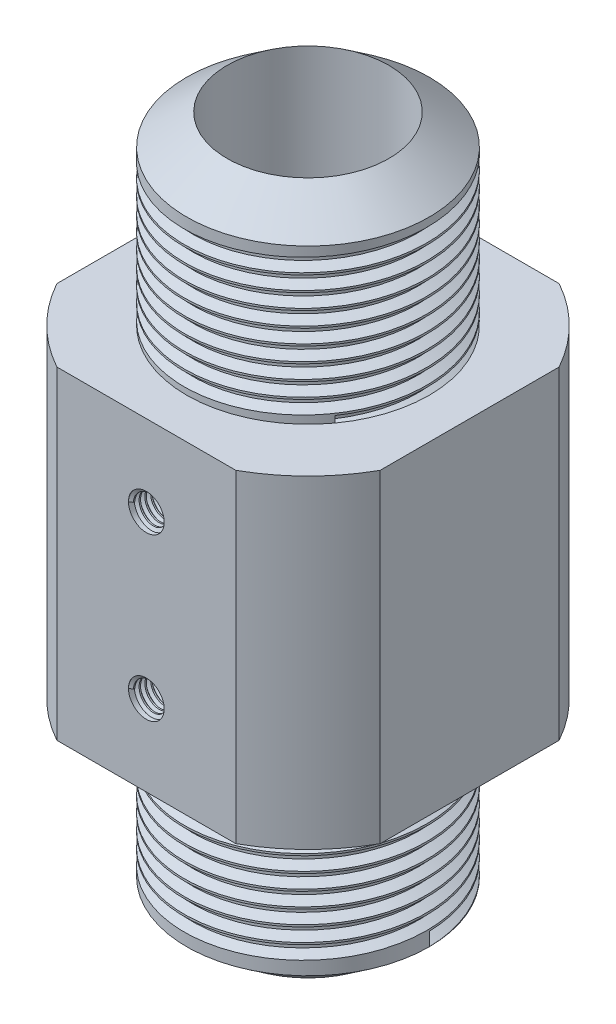
from build123d import *

# Parameters (mm, degrees)
SKETCH1_R                        = 25.4
SKETCH1_R_2                      = 11.1125
BOSS_EXTRUDE1_DEPTH              = 44.45
SKETCH2_R                        = 16.66875
SKETCH2_R_2                      = 11.1125
BOSS_EXTRUDE2_DEPTH              = 25.4
CUT_EXTRUDE1_START               = -44.45
CUT_EXTRUDE1_DEPTH               = 44.45
CUT_EXTRUDE2_START               = -44.45
CUT_EXTRUDE2_DEPTH               = 44.45
CIRPATTERN2_COUNT                = 3
CIRPATTERN2_ANGLE                = 180
THREAD2_PITCH                    = 2.116666667
THREAD3_PITCH                    = 2.116666667
F_10_0_1935_DIAMETER_HOLE1_D     = 4.9149
F_10_0_1935_DIAMETER_HOLE1_DEPTH = 7.112
F_10_0_1935_DIAMETER_HOLE1_TIP   = 1.476584928
THREAD4_PITCH                    = 0.79375
THREAD5_PITCH                    = 0.79375


with BuildPart() as part:
    # Sketch1 → Boss-Extrude1 (new body)
    with BuildSketch(Plane(origin=(0, 0, 0), x_dir=(1, 0, 0), z_dir=(0, 1, 0))):
        with Locations(Location((0, 0, 0), (0, 0, 270))):
            Circle(SKETCH1_R)
        with Locations(Location((0, 0, 0), (0, 0, 270))):
            Circle(SKETCH1_R_2, mode=Mode.SUBTRACT)
    extrude(amount=BOSS_EXTRUDE1_DEPTH)

    # Sketch2 → Boss-Extrude2 (add)
    with BuildSketch(Plane(origin=(0, 44.45, 0), x_dir=(1, 0, 0), z_dir=(0, 1, 0))):
        with Locations(Location((0, 0, 0), (0, 0, 270))):
            Circle(SKETCH2_R)
        with Locations(Location((0, 0, 0), (0, 0, 270))):
            Circle(SKETCH2_R_2, mode=Mode.SUBTRACT)
    boss_extrude2 = extrude(amount=BOSS_EXTRUDE2_DEPTH)

    # Sketch3 → Cut-Revolve1 (revolve, cut)
    with BuildSketch(Plane(origin=(0, 0, 0), x_dir=(0, 0, -1), z_dir=(1, 0, 0))):
        Polygon((16.66875, 69.85), (16.66875, 65.663065309), (11.1125, 69.85), align=None)
    cut_revolve1 = revolve(axis=Axis((0, 69.85, 0), (0, 1, 0)), mode=Mode.SUBTRACT)

    # Sketch4 → Cut-Extrude1 (cut)
    with BuildSketch(Plane(origin=(0, 44.45, 0), x_dir=(1, 0, 0), z_dir=(0, 1, 0)).offset(CUT_EXTRUDE1_START)):
        with BuildLine():
            Line((12.296722124, -22.225), (-12.296722124, -22.225))
            ThreePointArc((-12.296722124, -22.225), (0, -25.4), (12.296722124, -22.225))
        make_face()
    extrude(amount=CUT_EXTRUDE1_DEPTH, mode=Mode.SUBTRACT)

    # Sketch19 → Cut-Extrude2 (cut)
    with BuildSketch(Plane(origin=(0, 44.45, 0), x_dir=(1, 0, 0), z_dir=(0, 1, 0)).offset(CUT_EXTRUDE2_START)):
        with BuildLine():
            Line((22.225, 12.296722124), (22.225, -12.296722124))
            ThreePointArc((22.225, -12.296722124), (25.4, 0), (22.225, 12.296722124))
        make_face()
    cut_extrude2 = extrude(amount=CUT_EXTRUDE2_DEPTH, mode=Mode.SUBTRACT)

    # CirPattern2: Cut-Extrude2 ×3 about axis
    cirpattern2_axis = Axis((0, 44.45, 0), (0, 1, 0))
    for i in range(1, CIRPATTERN2_COUNT):
        add(cut_extrude2.rotate(cirpattern2_axis, i * CIRPATTERN2_ANGLE / (CIRPATTERN2_COUNT - 1)), mode=Mode.SUBTRACT)

    # Mirror1: Boss-Extrude2, Cut-Revolve1 across plane
    add(boss_extrude2.mirror(Plane.ZX.offset(22.225)))
    add(cut_revolve1.mirror(Plane.ZX.offset(22.225)), mode=Mode.SUBTRACT)

    # Thread2: the profile of Thread Profile2 profile screwed along a right-hand helix of 9.6 turns, 10 arcs to a turn; built about Z, then put on its axis
    thread2_z = Axis((0, 0, 0), (0, 0, 1))
    thread2_corners = [(16.66905, 0, -0.000173205), (16.66905, 0, 1.852256533), (15.523070565, 0, 1.190624997), (15.523070565, 0, 0.66145833)]
    with BuildLine(mode=Mode.PRIVATE) as thread2_profile:
        Line(thread2_corners[0], thread2_corners[1])
        Line(thread2_corners[1], thread2_corners[2])
        Line(thread2_corners[2], thread2_corners[3])
        Line(thread2_corners[3], thread2_corners[0])
    thread2_cap = Face(thread2_profile.wire())
    thread2_turn_angles = [0, 18, 36, 54, 72, 90, 108, 126, 144, 162, 180, 198, 216, 234, 252, 270, 288, 306, 324, 342, 360]
    thread2_turn_weights = [1, 0.9510565162951535, 1, 0.9510565162951535, 1, 0.9510565162951535, 1, 0.9510565162951535, 1, 0.9510565162951535, 1, 0.9510565162951535, 1, 0.9510565162951535, 1, 0.9510565162951535, 1, 0.9510565162951535, 1, 0.9510565162951535, 1]
    thread2_turn_rails = [Edge.make_bspline([Vector(p[0], p[1], 0).rotate(thread2_z, thread2_turn_angles[k]) / thread2_turn_weights[k] + Vector(0, 0, p[2] + THREAD2_PITCH * thread2_turn_angles[k] / 360) for k in range(21)], [0, 0, 0, 1, 1, 2, 2, 3, 3, 4, 4, 5, 5, 6, 6, 7, 7, 8, 8, 9, 9, 10, 10, 10], 2, thread2_turn_weights) for p in thread2_corners]
    thread2_turn_sides = [Face.make_surface_from_curves(thread2_turn_rails[p[0]], thread2_turn_rails[p[1]]) for p in [(0, 1), (1, 2), (2, 3), (3, 0)]]
    thread2_last_angles = [3240, 3258, 3276, 3294, 3312, 3330, 3348, 3366, 3384, 3402, 3420, 3438, 3456]
    thread2_last_weights = [1, 0.9510565162951535, 1, 0.9510565162951535, 1, 0.9510565162951535, 1, 0.9510565162951535, 1, 0.9510565162951535, 1, 0.9510565162951535, 1]
    thread2_last_rails = [Edge.make_bspline([Vector(p[0], p[1], 0).rotate(thread2_z, thread2_last_angles[k]) / thread2_last_weights[k] + Vector(0, 0, p[2] + THREAD2_PITCH * thread2_last_angles[k] / 360) for k in range(13)], [0, 0, 0, 1, 1, 2, 2, 3, 3, 4, 4, 5, 5, 6, 6, 6], 2, thread2_last_weights) for p in thread2_corners]
    thread2_last_sides = [Face.make_surface_from_curves(thread2_last_rails[p[0]], thread2_last_rails[p[1]]) for p in [(0, 1), (1, 2), (2, 3), (3, 0)]]
    thread2 = Plane(origin=(0, 65.663065309, 0), x_dir=(-1, 0, 0), z_dir=(0, -1, 0)) * Solid(Shell([*[p.moved(Location((0, 0, THREAD2_PITCH * i))) for i in range(9) for p in thread2_turn_sides], *thread2_last_sides, thread2_cap, thread2_cap.rotate(thread2_z, 3456).moved(Location((0, 0, THREAD2_PITCH * 3456 / 360)))]))
    add(thread2, mode=Mode.SUBTRACT)

    # Thread3: the profile of Thread Profile3 profile screwed along a right-hand helix of 9.6 turns, 10 arcs to a turn; built about Z, then put on its axis
    thread3_z = Axis((0, 0, 0), (0, 0, 1))
    thread3_corners = [(16.66905, 0, -0.000173205), (16.66905, 0, 1.852256533), (15.523070565, 0, 1.190624997), (15.523070565, 0, 0.66145833)]
    with BuildLine(mode=Mode.PRIVATE) as thread3_profile:
        Line(thread3_corners[0], thread3_corners[1])
        Line(thread3_corners[1], thread3_corners[2])
        Line(thread3_corners[2], thread3_corners[3])
        Line(thread3_corners[3], thread3_corners[0])
    thread3_cap = Face(thread3_profile.wire())
    thread3_turn_angles = [0, 18, 36, 54, 72, 90, 108, 126, 144, 162, 180, 198, 216, 234, 252, 270, 288, 306, 324, 342, 360]
    thread3_turn_weights = [1, 0.9510565162951535, 1, 0.9510565162951535, 1, 0.9510565162951535, 1, 0.9510565162951535, 1, 0.9510565162951535, 1, 0.9510565162951535, 1, 0.9510565162951535, 1, 0.9510565162951535, 1, 0.9510565162951535, 1, 0.9510565162951535, 1]
    thread3_turn_rails = [Edge.make_bspline([Vector(p[0], p[1], 0).rotate(thread3_z, thread3_turn_angles[k]) / thread3_turn_weights[k] + Vector(0, 0, p[2] + THREAD3_PITCH * thread3_turn_angles[k] / 360) for k in range(21)], [0, 0, 0, 1, 1, 2, 2, 3, 3, 4, 4, 5, 5, 6, 6, 7, 7, 8, 8, 9, 9, 10, 10, 10], 2, thread3_turn_weights) for p in thread3_corners]
    thread3_turn_sides = [Face.make_surface_from_curves(thread3_turn_rails[p[0]], thread3_turn_rails[p[1]]) for p in [(0, 1), (1, 2), (2, 3), (3, 0)]]
    thread3_last_angles = [3240, 3258, 3276, 3294, 3312, 3330, 3348, 3366, 3384, 3402, 3420, 3438, 3456]
    thread3_last_weights = [1, 0.9510565162951535, 1, 0.9510565162951535, 1, 0.9510565162951535, 1, 0.9510565162951535, 1, 0.9510565162951535, 1, 0.9510565162951535, 1]
    thread3_last_rails = [Edge.make_bspline([Vector(p[0], p[1], 0).rotate(thread3_z, thread3_last_angles[k]) / thread3_last_weights[k] + Vector(0, 0, p[2] + THREAD3_PITCH * thread3_last_angles[k] / 360) for k in range(13)], [0, 0, 0, 1, 1, 2, 2, 3, 3, 4, 4, 5, 5, 6, 6, 6], 2, thread3_last_weights) for p in thread3_corners]
    thread3_last_sides = [Face.make_surface_from_curves(thread3_last_rails[p[0]], thread3_last_rails[p[1]]) for p in [(0, 1), (1, 2), (2, 3), (3, 0)]]
    thread3 = Plane(origin=(0, -21.213065309, 0), x_dir=(1, 0, 0), z_dir=(0, 1, 0)) * Solid(Shell([*[p.moved(Location((0, 0, THREAD3_PITCH * i))) for i in range(9) for p in thread3_turn_sides], *thread3_last_sides, thread3_cap, thread3_cap.rotate(thread3_z, 3456).moved(Location((0, 0, THREAD3_PITCH * 3456 / 360)))]))
    add(thread3, mode=Mode.SUBTRACT)

    # #10 (0.1935) Diameter Hole1
    with Locations(Plane.XY.offset(22.225)):
        with Locations((0, 33.3375), (0, 11.1125)):
            Hole(F_10_0_1935_DIAMETER_HOLE1_D / 2, depth=F_10_0_1935_DIAMETER_HOLE1_DEPTH)
            with Locations((0, 0, -(F_10_0_1935_DIAMETER_HOLE1_DEPTH + F_10_0_1935_DIAMETER_HOLE1_TIP / 2))):  # 118° drill point
                Cone(0, F_10_0_1935_DIAMETER_HOLE1_D / 2, F_10_0_1935_DIAMETER_HOLE1_TIP, mode=Mode.SUBTRACT)

    # Thread4: the profile of Thread Profile4 profile screwed along a right-hand helix of 8 turns, 8 arcs to a turn; built about Z, then put on its axis
    thread4_z = Axis((0, 0, 0), (0, 0, 1))
    thread4_corners = [(2.45775, 0, -0.000173205), (2.45775, 0, 0.694704453), (2.027820212, 0, 0.446484374), (2.027820212, 0, 0.248046874)]
    with BuildLine(mode=Mode.PRIVATE) as thread4_profile:
        Line(thread4_corners[0], thread4_corners[1])
        Line(thread4_corners[1], thread4_corners[2])
        Line(thread4_corners[2], thread4_corners[3])
        Line(thread4_corners[3], thread4_corners[0])
    thread4_cap = Face(thread4_profile.wire())
    thread4_turn_angles = [0, 22.5, 45, 67.5, 90, 112.5, 135, 157.5, 180, 202.5, 225, 247.5, 270, 292.5, 315, 337.5, 360]
    thread4_turn_weights = [1, 0.9238795325112867, 1, 0.9238795325112867, 1, 0.9238795325112867, 1, 0.9238795325112867, 1, 0.9238795325112867, 1, 0.9238795325112867, 1, 0.9238795325112867, 1, 0.9238795325112867, 1]
    thread4_turn_rails = [Edge.make_bspline([Vector(p[0], p[1], 0).rotate(thread4_z, thread4_turn_angles[k]) / thread4_turn_weights[k] + Vector(0, 0, p[2] + THREAD4_PITCH * thread4_turn_angles[k] / 360) for k in range(17)], [0, 0, 0, 1, 1, 2, 2, 3, 3, 4, 4, 5, 5, 6, 6, 7, 7, 8, 8, 8], 2, thread4_turn_weights) for p in thread4_corners]
    thread4_turn_sides = [Face.make_surface_from_curves(thread4_turn_rails[p[0]], thread4_turn_rails[p[1]]) for p in [(0, 1), (1, 2), (2, 3), (3, 0)]]
    thread4 = Plane(origin=(0, 33.3375, 22.225), x_dir=(-1, 0, 0), z_dir=(0, 0, -1)) * Solid(Shell([*[p.moved(Location((0, 0, THREAD4_PITCH * i))) for i in range(8) for p in thread4_turn_sides], thread4_cap, thread4_cap.rotate(thread4_z, 2880).moved(Location((0, 0, THREAD4_PITCH * 2880 / 360)))]))
    add(thread4)

    # Thread5: the profile of Thread Profile5 profile screwed along a right-hand helix of 8 turns, 8 arcs to a turn; built about Z, then put on its axis
    thread5_z = Axis((0, 0, 0), (0, 0, 1))
    thread5_corners = [(2.45775, 0, -0.000173205), (2.45775, 0, 0.694704453), (2.027820212, 0, 0.446484374), (2.027820212, 0, 0.248046874)]
    with BuildLine(mode=Mode.PRIVATE) as thread5_profile:
        Line(thread5_corners[0], thread5_corners[1])
        Line(thread5_corners[1], thread5_corners[2])
        Line(thread5_corners[2], thread5_corners[3])
        Line(thread5_corners[3], thread5_corners[0])
    thread5_cap = Face(thread5_profile.wire())
    thread5_turn_angles = [0, 22.5, 45, 67.5, 90, 112.5, 135, 157.5, 180, 202.5, 225, 247.5, 270, 292.5, 315, 337.5, 360]
    thread5_turn_weights = [1, 0.9238795325112867, 1, 0.9238795325112867, 1, 0.9238795325112867, 1, 0.9238795325112867, 1, 0.9238795325112867, 1, 0.9238795325112867, 1, 0.9238795325112867, 1, 0.9238795325112867, 1]
    thread5_turn_rails = [Edge.make_bspline([Vector(p[0], p[1], 0).rotate(thread5_z, thread5_turn_angles[k]) / thread5_turn_weights[k] + Vector(0, 0, p[2] + THREAD5_PITCH * thread5_turn_angles[k] / 360) for k in range(17)], [0, 0, 0, 1, 1, 2, 2, 3, 3, 4, 4, 5, 5, 6, 6, 7, 7, 8, 8, 8], 2, thread5_turn_weights) for p in thread5_corners]
    thread5_turn_sides = [Face.make_surface_from_curves(thread5_turn_rails[p[0]], thread5_turn_rails[p[1]]) for p in [(0, 1), (1, 2), (2, 3), (3, 0)]]
    thread5 = Plane(origin=(0, 11.1125, 22.225), x_dir=(-1, 0, 0), z_dir=(0, 0, -1)) * Solid(Shell([*[p.moved(Location((0, 0, THREAD5_PITCH * i))) for i in range(8) for p in thread5_turn_sides], thread5_cap, thread5_cap.rotate(thread5_z, 2880).moved(Location((0, 0, THREAD5_PITCH * 2880 / 360)))]))
    add(thread5)


solid = part.part
